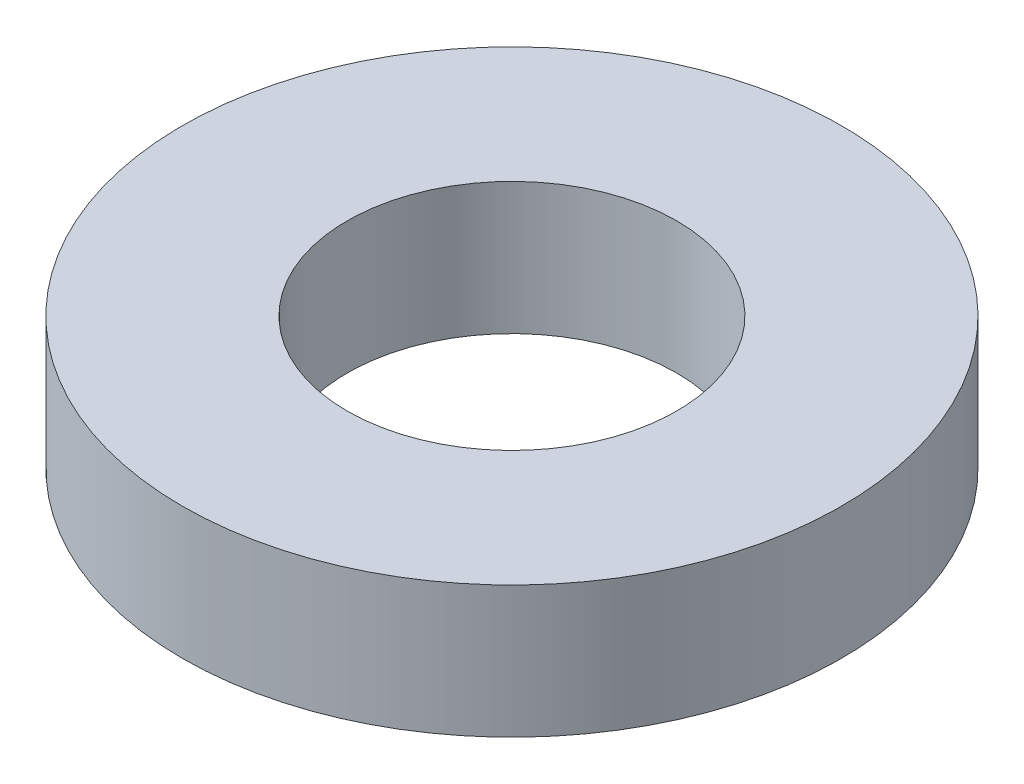
from build123d import *

# Parameters (mm, degrees)
SKETCH1_R           = 6.35
SKETCH1_R_2         = 3.175
BOSS_EXTRUDE1_DEPTH = 2.54


with BuildPart() as part:
    # Sketch1 → Boss-Extrude1 (new body)
    with BuildSketch(Plane(origin=(0, 0, 0), x_dir=(1, 0, 0), z_dir=(0, 1, 0))):
        Circle(SKETCH1_R)
        Circle(SKETCH1_R_2, mode=Mode.SUBTRACT)
    extrude(amount=BOSS_EXTRUDE1_DEPTH)


solid = part.part
